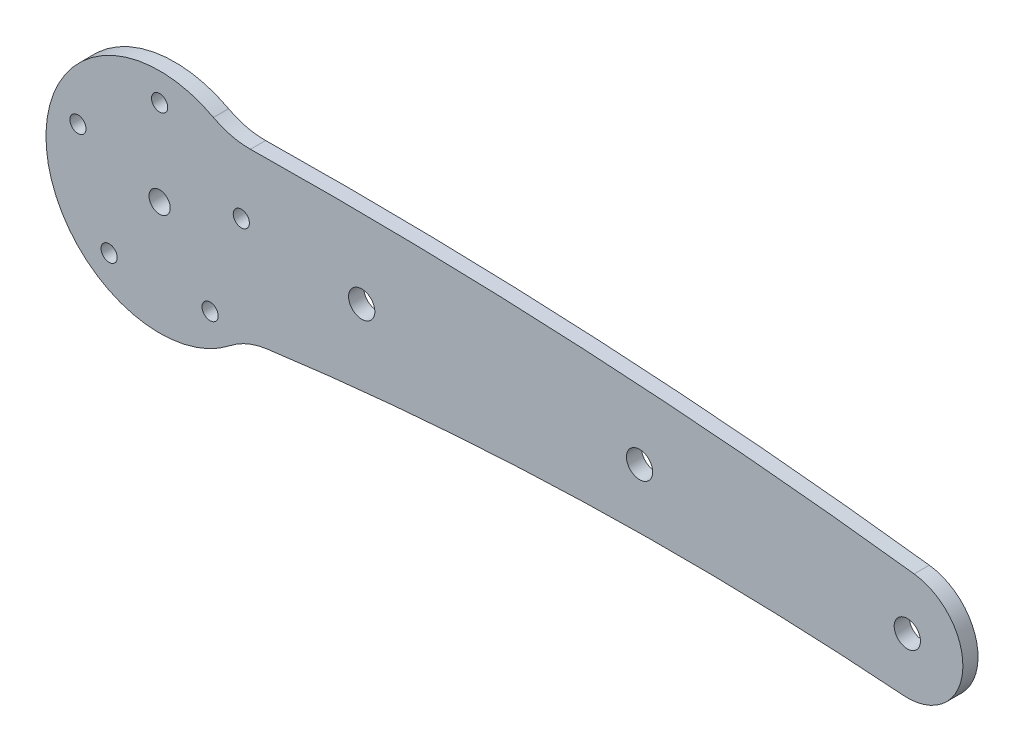
from build123d import *

# Parameters (mm, degrees)
BOSS_EXTRUDE1_START     = -5
BOSS_EXTRUDE1_OUTLINE_R = 1.925
BOSS_EXTRUDE1_DEPTH     = 5
SKETCH4_R               = 1.6
CUT_EXTRUDE2_DEPTH      = 161.661912101
FILLET1_R               = 15
SKETCH5_R               = 2.1
SKETCH5_R_2             = 2.6
CUT_EXTRUDE4_DEPTH      = 161.661912218
SKETCH6_W               = 233.09675901
SKETCH6_H               = 87.107773224
CUT_EXTRUDE5_DEPTH      = 2


with BuildPart() as part:
    # Boss-Extrude1: read off the stored shape, not the designer's step
    # Boss-Extrude1 outline → Boss-Extrude1 (new body)
    with BuildSketch(Plane.XY.offset(5).offset(BOSS_EXTRUDE1_START)):
        with BuildLine():
            ThreePointArc((149.353851183, 10.916367847), (81.584978704, 16.866619507), (13.564040933, 17.951790818))
            ThreePointArc((13.564040933, 17.951790818), (-22.408339146, -2.028875729), (16.567779435, -15.223622585))
            ThreePointArc((16.567779435, -15.223622585), (81.747231754, -9.530296146), (147.159069574, -10.96780908))
            ThreePointArc((147.159069574, -10.96780908), (158.945093507, -1.097692183), (149.353851183, 10.916367847))
        make_face()
        with Locations((40, 2.5)):
            Circle(BOSS_EXTRUDE1_OUTLINE_R, mode=Mode.SUBTRACT)
        with Locations((95, 2.5)):
            Circle(BOSS_EXTRUDE1_OUTLINE_R, mode=Mode.SUBTRACT)
    extrude(amount=BOSS_EXTRUDE1_DEPTH)

    # Sketch4 → Cut-Extrude2 (cut, through all)
    with BuildSketch(Plane.XY.offset(5)):
        with Locations((0, 17)):
            Circle(SKETCH4_R)
        with Locations((16.167960777, 5.253288904)):
            Circle(SKETCH4_R)
        with Locations((9.992349289, -13.753288904)):
            Circle(SKETCH4_R)
        with Locations((-9.992349289, -13.753288904)):
            Circle(SKETCH4_R)
        with Locations((-16.167960777, 5.253288904)):
            Circle(SKETCH4_R)
    extrude(amount=-CUT_EXTRUDE2_DEPTH, mode=Mode.SUBTRACT)

    # Fillet1
    fillet1_edges = [part.edges().sort_by_distance(p)[0] for p in [
        (16.567779435, -15.223622585, 2.5),
        (13.564040933, 17.951790818, 2.5),
    ]]
    fillet(fillet1_edges, radius=FILLET1_R)

    # Sketch5 → Cut-Extrude4 (cut, through all)
    with BuildSketch(Plane.XY.offset(5)):
        Circle(SKETCH5_R)
        with Locations((148, 0)):
            Circle(SKETCH5_R_2)
        with Locations((95, 2.5)):
            Circle(SKETCH5_R_2)
        with Locations((40, 2.5)):
            Circle(SKETCH5_R_2)
    extrude(amount=-CUT_EXTRUDE4_DEPTH, mode=Mode.SUBTRACT)

    # Sketch6 → Cut-Extrude5 (cut)
    with BuildSketch(Plane.XY.offset(5)):
        with Locations((68.481602645, 0)):
            Rectangle(SKETCH6_W, SKETCH6_H)
    extrude(amount=-CUT_EXTRUDE5_DEPTH, mode=Mode.SUBTRACT)


solid = part.part
